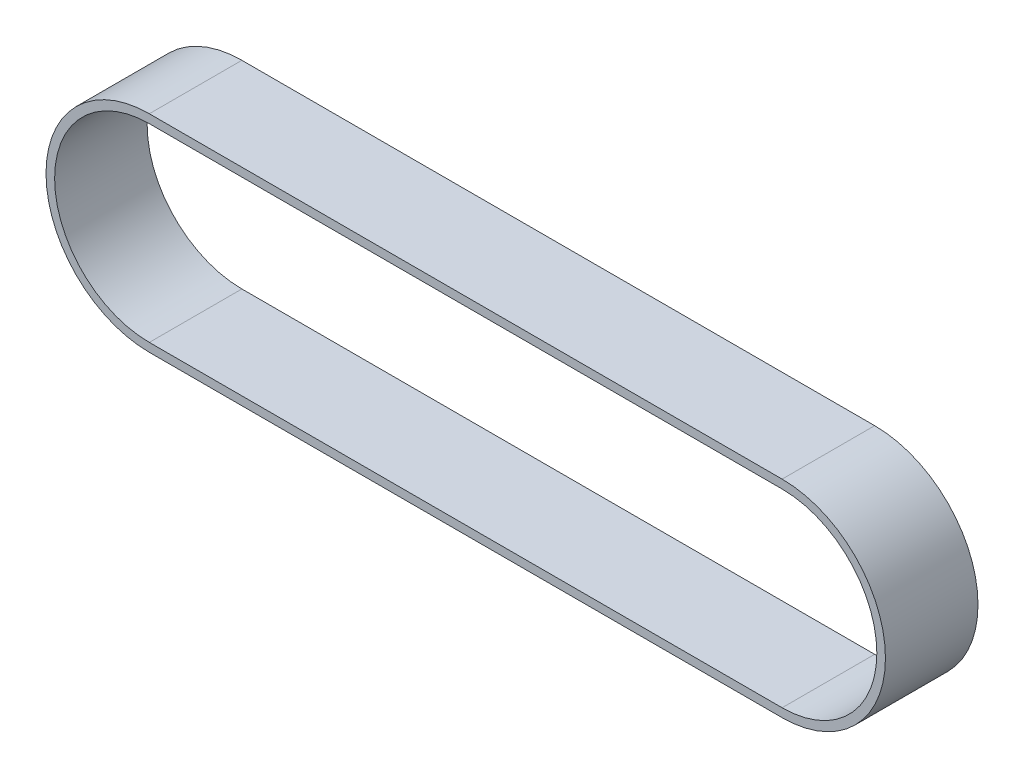
from build123d import *

# Parameters (mm, degrees)
BOSS_EXTRUDE1_DEPTH = 21.5


with BuildPart() as part:
    # Sketch1 → Boss-Extrude1 (new body)
    with BuildSketch(Plane.XY):
        with BuildLine():
            Line((-73.5, 24), (73.5, 24))
            ThreePointArc((73.5, 24), (97.5, 0), (73.5, -24))
            Line((73.5, -24), (-73.5, -24))
            ThreePointArc((-73.5, -24), (-97.5, 0), (-73.5, 24))
        make_face()
        with BuildLine():
            Line((-73.5, 22), (73.5, 22))
            ThreePointArc((73.5, 22), (95.5, 0), (73.5, -22))
            Line((73.5, -22), (-73.5, -22))
            ThreePointArc((-73.5, -22), (-95.5, 0), (-73.5, 22))
        make_face(mode=Mode.SUBTRACT)
    extrude(amount=BOSS_EXTRUDE1_DEPTH)


solid = part.part
